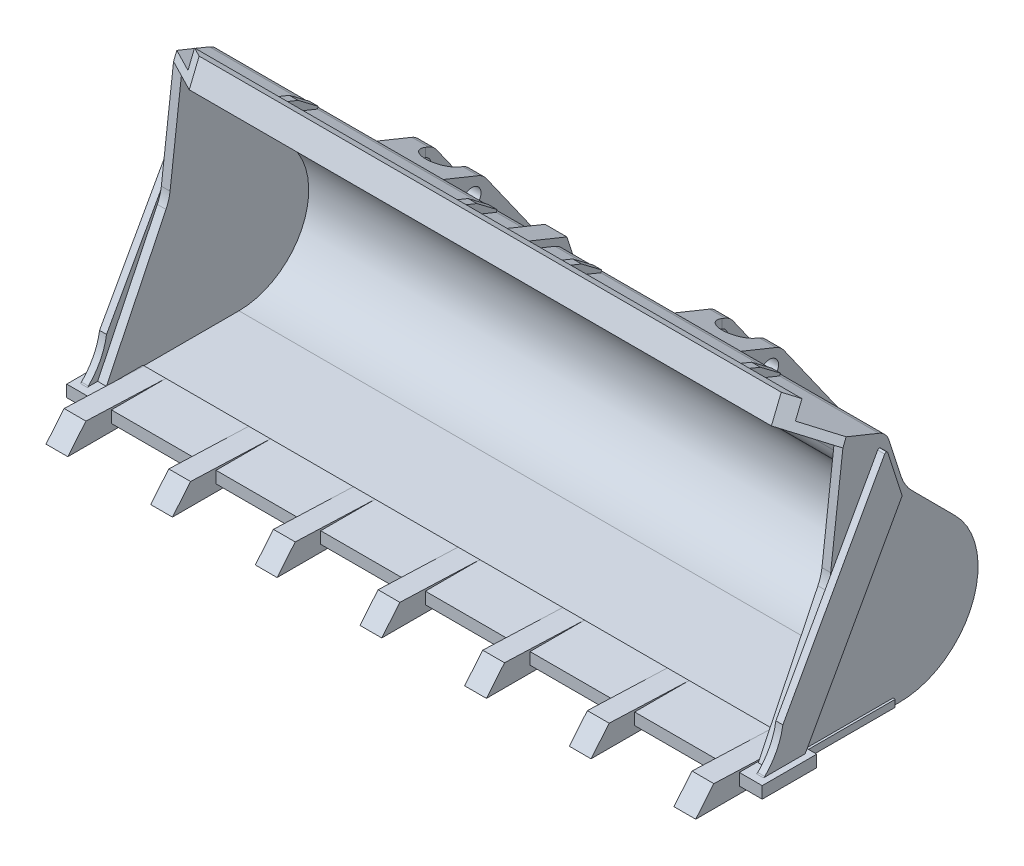
from build123d import *
from OCP.BRepFilletAPI import BRepFilletAPI_MakeChamfer

# Parameters (mm, degrees)
BOSS_EXTRUDE1_DEPTH            = 38.375
FILLET1_R                      = 5
FILLET2_R                      = 2
FILLET3_R                      = 5
SHELL1_DEPTH                   = 37.375
SKETCH2_W                      = 6.25
SKETCH2_H                      = 1.35
BOSS_EXTRUDE2_DEPTH            = 39.875
SKETCH3_W                      = 10.25
SKETCH3_H                      = 0.8
BOSS_EXTRUDE3_DEPTH            = 38.625
BOSS_EXTRUDE4_DEPTH            = 0.8
FILLET4_R                      = 0.2
CUT_EXTRUDE1_REACH             = 52.96
CUT_EXTRUDE1_DIRECTION_2_DEPTH = 51.959549416
BOSS_EXTRUDE5_START            = 1.25
BOSS_EXTRUDE5_DEPTH            = 1.25
SKETCH7_W                      = 1
SKETCH7_H                      = 6.496982244
BOSS_EXTRUDE6_DEPTH            = 1
CHAMFER1_SIZE                  = 0.75
CHAMFER1_SIZE2                 = 2.799038106
BOSS_EXTRUDE7_DEPTH            = 20.875
CUT_EXTRUDE2_DEPTH             = 60.110831635
CUT_EXTRUDE2_DEPTH_BACK        = 41.75
SKETCH9_W                      = 26.5
SKETCH9_H                      = 37.414770241
CUT_EXTRUDE3_DEPTH             = 60.110831635
CUT_EXTRUDE3_DEPTH_BACK        = 60.110831635
SKETCH10_R                     = 1.05
BOSS_EXTRUDE8_DEPTH            = 1.25
LPATTERN1_COUNT                = 4
LPATTERN1_PITCH                = 12
LPATTERN1_COL_COUNT            = 4
LPATTERN1_COL_PITCH            = 12


# Read off the part's stored shape, not the designer's step: Shell1
with BuildPart() as part:
    # Sketch1 → Boss-Extrude1 (new body)
    with BuildSketch(Plane(origin=(0, 0, 0), x_dir=(0, 0, -1), z_dir=(1, 0, 0))):
        with BuildLine():
            Line((15.25, 0), (0, 0))
            Line((0, 0), (0, 1))
            Line((0, 1), (7.25, 16))
            Line((7.25, 16), (8.75, 28.5))
            Line((8.75, 28.5), (5.553252135, 29.797421707))
            Line((5.553252135, 29.797421707), (6.681444923, 32.577202459))
            Line((6.681444923, 32.577202459), (7.608038507, 32.201138196))
            Line((7.608038507, 32.201138196), (6.855909982, 30.347951028))
            Line((6.855909982, 30.347951028), (13.740127414, 27.553944899))
            Line((13.740127414, 27.553944899), (15.792332521, 21.203944899))
            Line((15.792332521, 21.203944899), (21.623961423, 15.353944899))
            ThreePointArc((21.623961423, 15.353944899), (23.562205005, 5.549311959), (15.25, 0))
        make_face()
    extrude(amount=BOSS_EXTRUDE1_DEPTH)

    # Fillet1
    fillet1_edges = [part.edges().sort_by_distance(p)[0] for p in [
        (19.1875, 21.203944899, -15.792332521),
    ]]
    fillet(fillet1_edges, radius=FILLET1_R)

    # Fillet2
    fillet2_edges = [part.edges().sort_by_distance(p)[0] for p in [
        (19.1875, 27.553944899, -13.740127414),
    ]]
    fillet(fillet2_edges, radius=FILLET2_R)

    # Fillet3
    fillet3_edges = [part.edges().sort_by_distance(p)[0] for p in [
        (19.1875, 16, -7.25),
    ]]
    fillet(fillet3_edges, radius=FILLET3_R)

    # Shell1 outline → Shell1 (cut)
    with BuildSketch(Plane.YZ):
        with BuildLine():
            ThreePointArc((26.359001958, -13.075384834), (26.732328377, -12.856268859), (26.978074606, -12.499907783))
            Line((26.978074606, -12.499907783), (28.5, -8.75))
            Line((28.5, -8.75), (16.828671243, -7.349440549))
            ThreePointArc((16.828671243, -7.349440549), (16.019438965, -7.183607383), (15.248554043, -6.886801121))
            Line((15.248554043, -6.886801121), (1, 0))
            Line((1, 0), (1, -15.25))
            ThreePointArc((1, -15.25), (5.932721741, -22.638626671), (14.647951021, -20.915743487))
            Line((14.647951021, -20.915743487), (19.647810605, -15.931585255))
            ThreePointArc((19.647810605, -15.931585255), (20.75683177, -15.060127977), (22.038648253, -14.471644982))
            Line((22.038648253, -14.471644982), (26.359001958, -13.075384834))
        make_face()
    extrude(amount=SHELL1_DEPTH, mode=Mode.SUBTRACT)

    # Sketch2 → Boss-Extrude2 (add)
    with BuildSketch(Plane(origin=(0, 0, 0), x_dir=(0, 0, -1), z_dir=(1, 0, 0))):
        with Locations((1.125, 0.425)):
            Rectangle(SKETCH2_W, SKETCH2_H)
    extrude(amount=BOSS_EXTRUDE2_DEPTH)

    # Sketch3 → Boss-Extrude3 (add)
    with BuildSketch(Plane(origin=(0, 0, 0), x_dir=(0, 0, -1), z_dir=(1, 0, 0))):
        with Locations((9.375, 0.4)):
            Rectangle(SKETCH3_W, SKETCH3_H)
    extrude(amount=BOSS_EXTRUDE3_DEPTH)

    # Sketch4 → Boss-Extrude4 (add)
    with BuildSketch(Plane(origin=(38.375, 0, 0), x_dir=(0, 0, -1), z_dir=(1, 0, 0))):
        with BuildLine():
            Line((-1.4, 0.8), (3.459254788, 0.8))
            Line((3.459254788, 0.8), (14.751696416, 21.17210397))
            Line((14.751696416, 21.17210397), (12.962021875, 26.709773325))
            Line((12.962021875, 26.709773325), (1.066675279, 5.25))
            ThreePointArc((1.066675279, 5.25), (0.233575409, 2.803144582), (-1.4, 0.8))
        make_face()
    extrude(amount=BOSS_EXTRUDE4_DEPTH)

    # Fillet4
    fillet4_edges = [part.edges().sort_by_distance(p)[0] for p in [
        (38.775, 1.1, 1.070915731),
        (38.775, 21.17210397, -14.751696416),
        (38.775, 26.709773325, -12.962021875),
    ]]
    fillet(fillet4_edges, radius=FILLET4_R)

    # Sketch5 → Cut-Extrude1 (cut, up to next)
    with BuildSketch(Plane(origin=(0, 28.445014101, -11.544601043), x_dir=(1, 0, 0), z_dir=(0, 0.9265935841802968, -0.3760642628008029)), mode=Mode.PRIVATE) as cut_extrude1_sk1:
        Polygon((38.375, -2.610137628), (38.375, -6.060137628), (33.375, -6.060137628), align=None)
    cut_extrude1_tool1 = extrude(cut_extrude1_sk1.sketch, amount=-CUT_EXTRUDE1_REACH, mode=Mode.PRIVATE) & part.part
    add(cut_extrude1_tool1.solids().sort_by_distance((36.708333, 30.291541, -6.994899))[0], mode=Mode.SUBTRACT)

    # Sketch5 → Cut-Extrude1 direction 2 (cut)
    with BuildSketch(Plane(origin=(0, 28.445014101, -11.544601043), x_dir=(1, 0, 0), z_dir=(0, 0.9265935841802968, -0.3760642628008029))):
        Polygon((38.375, -2.610137628), (38.375, -6.060137628), (33.375, -6.060137628), align=None)
    extrude(amount=CUT_EXTRUDE1_DIRECTION_2_DEPTH, mode=Mode.SUBTRACT)

    # Sketch6 → Boss-Extrude5 (add)
    with BuildSketch(Plane(origin=(0, 0, 0), x_dir=(0, 0, -1), z_dir=(1, 0, 0)).offset(BOSS_EXTRUDE5_START)):
        with BuildLine():
            Line((12.875972045, 27.90466819), (9.169597709, 29.408925241))
            Line((9.169597709, 29.408925241), (9.451645906, 30.103870429))
            Line((9.451645906, 30.103870429), (14.225275672, 28.166460555))
            Line((14.225275672, 28.166460555), (15.567990813, 24.011787559))
            Line((15.567990813, 24.011787559), (14.949488958, 23.81189895))
            Line((14.949488958, 23.81189895), (14.026926149, 26.666522894))
            ThreePointArc((14.026926149, 26.666522894), (13.588694199, 27.413175733), (12.875972045, 27.90466819))
        make_face()
    extrude(amount=-BOSS_EXTRUDE5_DEPTH)

    # Sketch7 → Boss-Extrude6 (add)
    with BuildSketch(Plane(origin=(0, 28.445014101, -11.544601043), x_dir=(1, 0, 0), z_dir=(0, 0.9265935841802968, -0.3760642628008029))):
        with Locations((6, -1.811646506)):
            Rectangle(SKETCH7_W, SKETCH7_H)
        with Locations((26.5, -1.811646506)):
            Rectangle(SKETCH7_W, SKETCH7_H)
    extrude(amount=BOSS_EXTRUDE6_DEPTH)

    # Chamfer1: one chamfer whose edges measure the first distance from different faces: ONE call of the kernel's chamfer builder (chamfer() names one face for all edges)
    chamfer1_edges_1 = [part.edges().sort_by_distance(p)[0] for p in [
        (6, 28.831261774, -13.252036308),
    ]]
    chamfer1_side_1 = [part.faces().sort_by_distance(p)[0] for p in [
        (6, 28.367964982, -13.064004177),
    ]]
    chamfer1_edges_2 = [part.edges().sort_by_distance(p)[0] for p in [
        (26.5, 28.831261774, -13.252036308),
    ]]
    chamfer1_side_2 = [part.faces().sort_by_distance(p)[0] for p in [
        (26.5, 28.367964982, -13.064004177),
    ]]
    chamfer1 = BRepFilletAPI_MakeChamfer(part.part.solid().wrapped)
    for e in chamfer1_edges_1:
        chamfer1.Add(CHAMFER1_SIZE, CHAMFER1_SIZE2, e.wrapped, chamfer1_side_1[0].wrapped)  # the first distance lies on this face
    for e in chamfer1_edges_2:
        chamfer1.Add(CHAMFER1_SIZE, CHAMFER1_SIZE2, e.wrapped, chamfer1_side_2[0].wrapped)  # the first distance lies on this face
    add(Compound.cast(chamfer1.Shape()), mode=Mode.REPLACE)

    # Mirror1: part across plane


with BuildPart() as part_1:
    add(part.part)
    add(part.part.mirror(Plane(origin=(0, 0, 0), x_dir=(0, 0, 1), z_dir=(1, 0, 0))))


with BuildPart() as body_2:
    # Sketch8 → Boss-Extrude7 (new, symmetric)
    with BuildSketch(Plane(origin=(0, 0, 0), x_dir=(0, 0, -1), z_dir=(1, 0, 0))):
        with BuildLine():
            Line((4.25, 0), (14.5, 0))
            Line((14.5, 0), (15.25, 0))
            ThreePointArc((15.25, 0), (23.562205005, 5.549311959), (21.623961423, 15.353944899))
            Line((21.623961423, 15.353944899), (16.639803191, 20.353804483))
            ThreePointArc((16.639803191, 20.353804483), (15.913588793, 21.277988786), (15.423186297, 22.346169189))
            Line((15.423186297, 22.346169189), (14.026926149, 26.666522894))
            Line((14.026926149, 26.666522894), (18.580033984, 24.818613335))
            ThreePointArc((18.580033984, 24.818613335), (19.070901685, 24.532257486), (19.461412737, 24.119399291))
            Line((19.461412737, 24.119399291), (26.78473757, 13.752862869))
            ThreePointArc((26.78473757, 13.752862869), (27.352705725, 12.701328249), (27.654908481, 11.545046978))
            Line((27.654908481, 11.545046978), (29.017211193, 1.578135076))
            ThreePointArc((29.017211193, 1.578135076), (28.661229136, 0.388770466), (27.531029461, -0.125))
            Line((27.531029461, -0.125), (4.25, -0.125))
            Line((4.25, -0.125), (4.25, 0))
        make_face()
    extrude(amount=BOSS_EXTRUDE7_DEPTH, both=True)

    # Sketch9 → Cut-Extrude2 (cut, two sides: drawn at the far end of the back side and taken through both)
    with BuildSketch(Plane(origin=(0, 0, 0), x_dir=(1, 0, 0), z_dir=(0, 1, 0)).offset(-CUT_EXTRUDE2_DEPTH_BACK)):
        with BuildLine():
            Line((-18.95, 18.231585255), (-18.95, 39.241029461))
            Line((-18.95, 39.241029461), (-15.05, 39.241029461))
            Line((-15.05, 39.241029461), (-15.05, 18.231585255))
            ThreePointArc((-15.05, 18.231585255), (-17, 16.281585255), (-18.95, 18.231585255))
        make_face()
        with Locations((0, 20.533644341)):
            Rectangle(SKETCH9_W, SKETCH9_H)
        with BuildLine():
            Line((15.05, 18.231585255), (15.05, 39.241029461))
            Line((15.05, 39.241029461), (18.95, 39.241029461))
            Line((18.95, 39.241029461), (18.95, 18.231585255))
            ThreePointArc((18.95, 18.231585255), (17, 16.281585255), (15.05, 18.231585255))
        make_face()
    extrude(amount=CUT_EXTRUDE2_DEPTH + CUT_EXTRUDE2_DEPTH_BACK, mode=Mode.SUBTRACT)


with BuildPart() as cut_extrude2_piece_1:
    # of the separate pieces the step leaves, piece 1, a body of its own (cut_extrude2_pieces)
    add(body_2.part.solids().sort_by_distance((13.25, 0, -4.25))[0])


with BuildPart() as cut_extrude2_piece_2:
    # of the separate pieces the step leaves, piece 2, a body of its own (cut_extrude2_pieces)
    add(body_2.part.solids().sort_by_distance((-20.875, 0, -4.25))[0])


with BuildPart() as cut_extrude3_tool:
    # Sketch10 → Cut-Extrude3 (new, two sides: drawn at the far end of the back side and taken through both)
    with BuildSketch(Plane(origin=(0, 0, 0), x_dir=(0, 0, -1), z_dir=(1, 0, 0)).offset(-CUT_EXTRUDE3_DEPTH_BACK)):
        with Locations((27.531029461, 1.375)):
            Circle(SKETCH10_R)
        with Locations((17.827905459, 22.965426167)):
            Circle(SKETCH10_R)
    extrude(amount=CUT_EXTRUDE3_DEPTH + CUT_EXTRUDE3_DEPTH_BACK)


with BuildPart() as cut_extrude2_piece_1_1:
    add(cut_extrude2_piece_1.part)

    # Cut-Extrude3: cut by cut_extrude3_tool
    add(cut_extrude3_tool.part, mode=Mode.SUBTRACT)


with BuildPart() as cut_extrude2_piece_2_1:
    add(cut_extrude2_piece_2.part)

    # Cut-Extrude3: cut by cut_extrude3_tool
    add(cut_extrude3_tool.part, mode=Mode.SUBTRACT)


with BuildPart() as part_2:
    add(part_1.part)

    # Combine1: union Cut-Extrude2 piece 1, Cut-Extrude2 piece 2
    add(cut_extrude2_piece_1_1.part)
    add(cut_extrude2_piece_2_1.part)

    # Sketch12 → Boss-Extrude8 (add, symmetric)
    with BuildSketch(Plane(origin=(0, 0, 0), x_dir=(0, 0, -1), z_dir=(1, 0, 0))):
        Polygon((4.25, 1.1), (3.75, -0.25), (3.75, -1.05), (-7, -1.05), (-4.923344034, 1.45), align=None)
    boss_extrude8 = extrude(amount=BOSS_EXTRUDE8_DEPTH, both=True)

    # LPattern1: Boss-Extrude8 ×4
    with Locations(*[(-i * LPATTERN1_PITCH, 0, 0) for i in range(1, LPATTERN1_COUNT)]):
        add(boss_extrude8)

    # LPattern1 col: Boss-Extrude8 ×4
    with Locations(*[(i * LPATTERN1_COL_PITCH, 0, 0) for i in range(1, LPATTERN1_COL_COUNT)]):
        add(boss_extrude8)


solid = part_2.part
